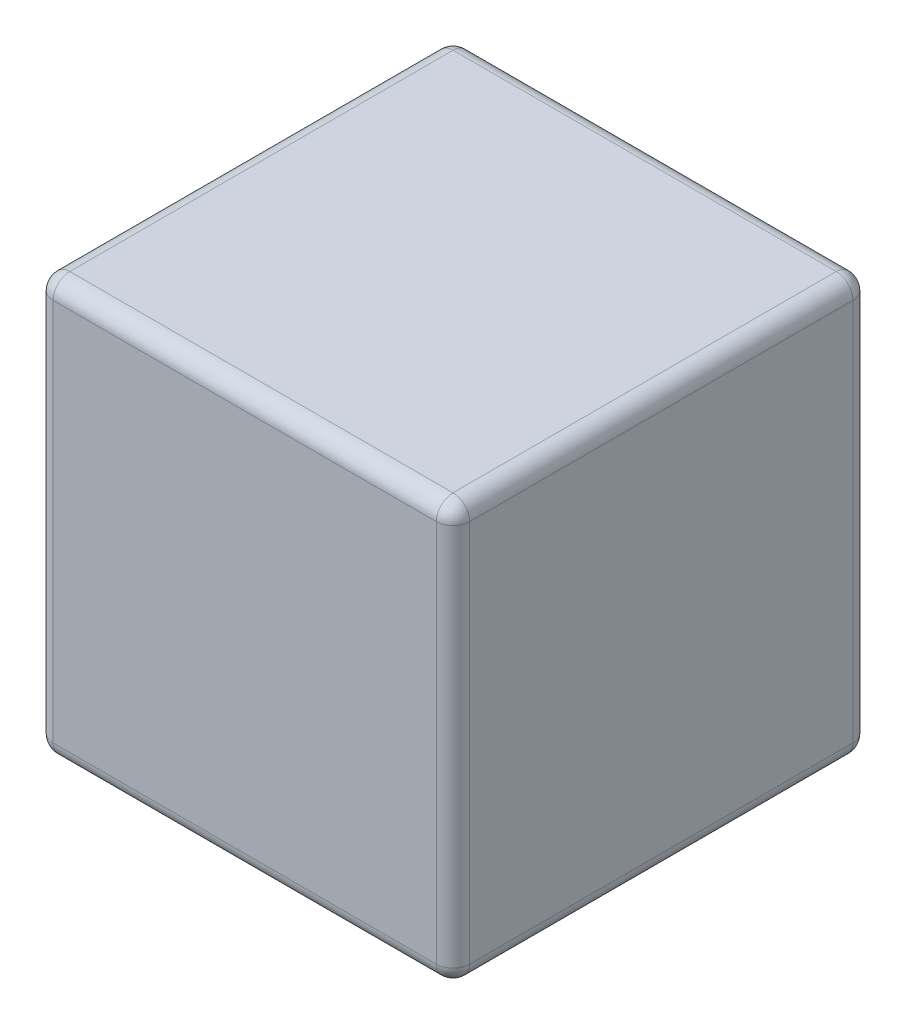
from build123d import *

# Parameters (mm, degrees)
SKETCH1_W           = 250
SKETCH1_H           = 250
BOSS_EXTRUDE1_DEPTH = 125
FILLET1_R           = 10
SKETCH2_W           = 2.243589744
SKETCH2_H           = 25
CUT_EXTRUDE1_DEPTH  = 5


with BuildPart() as part:
    # Sketch1 → Boss-Extrude1 (new, symmetric)
    with BuildSketch(Plane(origin=(0, 0, 0), x_dir=(1, 0, 0), z_dir=(0, 1, 0))):
        Rectangle(SKETCH1_W, SKETCH1_H)
    extrude(amount=BOSS_EXTRUDE1_DEPTH, both=True)

    # Fillet1
    fillet1_edges = [part.edges().sort_by_distance(p)[0] for p in [
        (-125, 0, -125),
        (0, -125, -125),
        (-125, -125, 0),
        (125, 0, -125),
        (125, -125, 0),
        (-125, 0, 125),
        (125, 0, 125),
        (0, -125, 125),
        (0, 125, 125),
        (-125, 125, 0),
        (0, 125, -125),
        (125, 125, 0),
    ]]
    fillet(fillet1_edges, radius=FILLET1_R)

    # Sketch2 → Cut-Extrude1 (cut)
    # profile 1 of 11: a face of its own
    with BuildSketch(Plane(origin=(0, 0, -125), x_dir=(-1, 0, 0), z_dir=(0, 0, -1))):
        Polygon((-103.958881832, 105.864219876), (-101.715292089, 105.864219876), (-101.715292089, 83.42832244), (-92.099907473, 83.42832244), (-92.099907473, 80.864219876), (-103.958881832, 80.864219876), align=None)
    # profile 2 of 11: a face of its own
    with BuildSketch(Plane(origin=(0, 0, -125), x_dir=(-1, 0, 0), z_dir=(0, 0, -1))):
        with Locations((-86.811445935, 93.364219876)):
            Rectangle(SKETCH2_W, SKETCH2_H)
    # profile 3 of 11: a face of its own
    with BuildSketch(Plane(origin=(0, 0, -125), x_dir=(-1, 0, 0), z_dir=(0, 0, -1))):
        Polygon((-79.279394653, 105.864219876), (-67.099907473, 105.864219876), (-67.099907473, 103.300117312), (-77.035804909, 103.300117312), (-77.035804909, 95.60780962), (-67.099907473, 95.60780962), (-67.099907473, 93.043707055), (-77.035804909, 93.043707055), (-77.035804909, 80.864219876), (-79.279394653, 80.864219876), align=None)
    # profile 4 of 11: a face of its own
    with BuildSketch(Plane(origin=(0, 0, -125), x_dir=(-1, 0, 0), z_dir=(0, 0, -1))):
        Polygon((-62.612727986, 105.864219876), (-48.510163884, 105.864219876), (-48.510163884, 103.300117312), (-60.369138243, 103.300117312), (-60.369138243, 95.60780962), (-48.510163884, 95.60780962), (-48.510163884, 93.043707055), (-60.369138243, 93.043707055), (-60.369138243, 83.42832244), (-48.510163884, 83.42832244), (-48.510163884, 80.864219876), (-62.612727986, 80.864219876), align=None)
    # profile 5 of 11: a face of its own
    with BuildSketch(Plane(origin=(0, 0, -125), x_dir=(-1, 0, 0), z_dir=(0, 0, -1))):
        with BuildLine():
            Line((-36.971702345, 85.686936222), (-34.858320935, 86.953963466))
            add(Edge.make_bspline(
                [(-34.858320935, 86.953963466), (-34.661762098, 86.624932145), (-34.28516295, 85.994520831), (-33.656938956, 85.142677685), (-33.005989591, 84.41866228), (-32.327494351, 83.826686512), (-31.625594722, 83.360623035), (-30.895708624, 83.030607094), (-30.14029569, 82.824778698), (-29.626196965, 82.79977808), (-29.369538884, 82.787296799)],
                knots=[0, 0, 0, 0, 1.272034388, 2.437168799, 3.508375237, 4.49857839, 5.41946034, 6.295179144, 7.148887113, 8, 8, 8, 8], degree=3))
            add(Edge.make_bspline(
                [(-29.369538884, 82.787296799), (-29.150347023, 82.793401603), (-28.715798644, 82.80550439), (-28.076068337, 82.921795833), (-27.45476975, 83.100453897), (-26.864708051, 83.356317694), (-26.314025091, 83.665878306), (-25.831120124, 84.039779574), (-25.413647887, 84.458395329), (-25.072154211, 84.925414291), (-24.810153959, 85.427679638), (-24.608782042, 85.943222147), (-24.497031516, 86.480140492), (-24.480197563, 86.841643798), (-24.471702345, 87.024075645)],
                knots=[0, 0, 0, 0, 1.095163259, 2.171163733, 3.241058638, 4.321873601, 5.38011039, 6.391990106, 7.366004449, 8.327778327, 9.272591725, 10.192022065, 11.087607919, 12, 12, 12, 12], degree=3))
            add(Edge.make_bspline(
                [(-24.471702345, 87.024075645), (-24.482233136, 87.232224572), (-24.503640695, 87.655360923), (-24.684579838, 88.279644158), (-24.969217315, 88.89744823), (-25.231807628, 89.279600127), (-25.36813664, 89.478001927)],
                knots=[0, 0, 0, 0, 0.938893495, 1.908633276, 2.914225137, 4, 4, 4, 4], degree=3))
            add(Edge.make_bspline(
                [(-25.36813664, 89.478001927), (-25.480069599, 89.621193524), (-25.715058844, 89.921806371), (-26.119041076, 90.369272339), (-26.59308475, 90.830832474), (-27.120967285, 91.324111453), (-27.72191792, 91.826167143), (-28.377114451, 92.360940557), (-29.103284872, 92.908094679), (-29.612566991, 93.275041576), (-29.875348179, 93.464380132)],
                knots=[0, 0, 0, 0, 0.722233717, 1.516239348, 2.393582979, 3.351407094, 4.387010283, 5.505090956, 6.712668013, 8, 8, 8, 8], degree=3))
            add(Edge.make_bspline(
                [(-29.875348179, 93.464380132), (-30.138376723, 93.651727187), (-30.64126727, 94.009920489), (-31.344542858, 94.541522517), (-31.973431879, 95.027550157), (-32.52513914, 95.472578815), (-32.999421975, 95.876668848), (-33.400017768, 96.235939842), (-33.716721747, 96.560108134), (-33.892833038, 96.770403432), (-33.971902666, 96.864820837)],
                knots=[0, 0, 0, 0, 1.452282411, 2.77665338, 3.964542531, 5.026858415, 5.96415736, 6.766646006, 7.446254459, 8, 8, 8, 8], degree=3))
            add(Edge.make_bspline(
                [(-33.971902666, 96.864820837), (-34.082420846, 97.011971101), (-34.29976968, 97.301361842), (-34.586669719, 97.753682255), (-34.830520882, 98.216705579), (-35.021680397, 98.69167604), (-35.182653389, 99.171925532), (-35.290924322, 99.663720144), (-35.358720014, 100.164853133), (-35.365662775, 100.502092423), (-35.369138243, 100.670910581)],
                knots=[0, 0, 0, 0, 1.068054152, 2.10047183, 3.106115577, 4.101338837, 5.06977816, 6.043150881, 7.020423561, 8, 8, 8, 8], degree=3))
            add(Edge.make_bspline(
                [(-35.369138243, 100.670910581), (-35.359815321, 100.935408971), (-35.341368749, 101.458752283), (-35.185365055, 102.223258215), (-34.9391301, 102.953161195), (-34.594166615, 103.641235007), (-34.149471237, 104.269563442), (-33.634857135, 104.845374064), (-33.021917947, 105.329435365), (-32.34939921, 105.752378639), (-31.613282266, 106.083420962), (-30.841918671, 106.333142249), (-30.034082442, 106.474636947), (-29.486917194, 106.494942411), (-29.209282473, 106.505245517)],
                knots=[0, 0, 0, 0, 1.005424448, 1.989358655, 2.955360095, 3.929531133, 4.905563448, 5.876582895, 6.856512386, 7.866279853, 8.892233794, 9.918561126, 10.94386622, 12, 12, 12, 12], degree=3))
            add(Edge.make_bspline(
                [(-29.209282473, 106.505245517), (-28.914681757, 106.495084434), (-28.328814959, 106.474877283), (-27.467034848, 106.299180631), (-26.637315445, 106.008461547), (-25.969863553, 105.678542561), (-25.447486686, 105.349032449), (-25.049110024, 105.048890847), (-24.645413947, 104.703354357), (-24.233142126, 104.311502599), (-23.819280273, 103.869740092), (-23.397684186, 103.381092314), (-22.96736798, 102.848545486), (-22.690540408, 102.468370481), (-22.548625422, 102.273474684)],
                knots=[0, 0, 0, 0, 1.286793592, 2.559021753, 3.825965368, 5.121522368, 5.803751409, 6.523245864, 7.299691795, 8.125521123, 9.008227632, 9.944561021, 10.946284179, 12, 12, 12, 12], degree=3))
            Line((-22.548625422, 102.273474684), (-24.576870614, 100.736014748))
            add(Edge.make_bspline(
                [(-24.576870614, 100.736014748), (-24.699341561, 100.893791108), (-24.935191968, 101.197631488), (-25.293259732, 101.623140885), (-25.630750074, 102.011830025), (-25.96325293, 102.349438082), (-26.27320744, 102.65445332), (-26.574043456, 102.91559444), (-26.861431679, 103.135420122), (-27.223695327, 103.370016979), (-27.678821886, 103.602563433), (-28.250140002, 103.799342562), (-28.847184824, 103.917593004), (-29.253825049, 103.933227915), (-29.459683114, 103.941142953)],
                knots=[0, 0, 0, 0, 1.181633172, 2.275549214, 3.290209073, 4.226197932, 5.078386478, 5.862611352, 6.581680152, 7.217281963, 8.414376989, 9.595101626, 10.782541182, 12, 12, 12, 12], degree=3))
            add(Edge.make_bspline(
                [(-29.459683114, 103.941142953), (-29.717943989, 103.932487953), (-30.215975756, 103.915797602), (-30.923048871, 103.733511992), (-31.55943405, 103.446498705), (-32.106238086, 103.044248861), (-32.561502208, 102.567670342), (-32.890826913, 102.019249948), (-33.089042375, 101.413661358), (-33.113230086, 100.991220956), (-33.125548499, 100.77607885)],
                knots=[0, 0, 0, 0, 1.14458467, 2.207223713, 3.21896685, 4.227309161, 5.202851033, 6.127160689, 7.046193047, 8, 8, 8, 8], degree=3))
            add(Edge.make_bspline(
                [(-33.125548499, 100.77607885), (-33.122740452, 100.642139718), (-33.117119765, 100.374042436), (-33.038728353, 99.977960851), (-32.938018861, 99.582879855), (-32.778428634, 99.190575692), (-32.558105037, 98.794187413), (-32.268782352, 98.386889287), (-31.904401551, 97.965091368), (-31.625280034, 97.690752984), (-31.477912281, 97.545910581)],
                knots=[0, 0, 0, 0, 0.858281714, 1.717966888, 2.583508476, 3.4729293, 4.427298488, 5.488583878, 6.674047936, 8, 8, 8, 8], degree=3))
            add(Edge.make_bspline(
                [(-31.477912281, 97.545910581), (-31.423188193, 97.497074682), (-31.293176284, 97.381051766), (-31.055491101, 97.191106904), (-30.74161397, 96.956801388), (-30.359741105, 96.666891984), (-29.902831378, 96.330595826), (-29.370834549, 95.952212882), (-28.769680743, 95.519459604), (-28.343095629, 95.216905742), (-28.117535679, 95.056928209)],
                knots=[0, 0, 0, 0, 0.420754252, 0.999615792, 1.744751191, 2.668019286, 3.750313428, 4.999500688, 6.413464383, 8, 8, 8, 8], degree=3))
            add(Edge.make_bspline(
                [(-28.117535679, 95.056928209), (-27.846207726, 94.859489927), (-27.320818752, 94.477178057), (-26.57326461, 93.902780343), (-25.895451695, 93.341010567), (-25.285000241, 92.795456231), (-24.735879466, 92.270255566), (-24.254181462, 91.759089993), (-23.834998031, 91.265621616), (-23.383717899, 90.632960361), (-22.922590616, 89.855952617), (-22.526579849, 88.903965198), (-22.276877367, 87.948277195), (-22.244223686, 87.305942649), (-22.228112602, 86.989019555)],
                knots=[0, 0, 0, 0, 1.163667725, 2.253281268, 3.268753668, 4.215851969, 5.092017293, 5.902905408, 6.650798638, 7.335211899, 8.59617414, 9.77448103, 10.901945474, 12, 12, 12, 12], degree=3))
            add(Edge.make_bspline(
                [(-22.228112602, 86.989019555), (-22.232806445, 86.764888376), (-22.242102982, 86.320978494), (-22.348966651, 85.669156516), (-22.505535688, 85.036078875), (-22.741515931, 84.429570929), (-23.02953849, 83.83853691), (-23.395011689, 83.278480479), (-23.818638008, 82.737006203), (-24.304593472, 82.228552693), (-24.836349917, 81.761794151), (-25.398376308, 81.346586569), (-25.991592543, 81.000384259), (-26.612780519, 80.717878244), (-27.262082924, 80.496924547), (-27.93928138, 80.336832625), (-28.645492175, 80.238577547), (-29.125495614, 80.228379251), (-29.369538884, 80.223194235)],
                knots=[0, 0, 0, 0, 0.983748083, 1.948392443, 2.894712957, 3.844097841, 4.80183111, 5.778335162, 6.776009319, 7.81870978, 8.863265674, 9.881300176, 10.883814829, 11.87499822, 12.874611388, 13.892143829, 14.928324115, 16, 16, 16, 16], degree=3))
            add(Edge.make_bspline(
                [(-29.369538884, 80.223194235), (-29.558362762, 80.226845532), (-29.933632477, 80.234102142), (-30.488700205, 80.298254145), (-31.032554413, 80.389019171), (-31.558370713, 80.53311967), (-32.072923654, 80.707955221), (-32.573975329, 80.923229025), (-33.061768571, 81.181209035), (-33.53903702, 81.476173497), (-34.004566838, 81.819443101), (-34.453991609, 82.21925379), (-34.90205722, 82.664578826), (-35.335538622, 83.167511421), (-35.763203939, 83.719926299), (-36.17662115, 84.326991894), (-36.584347704, 84.985401564), (-36.840172475, 85.448723605), (-36.971702345, 85.686936222)],
                knots=[0, 0, 0, 0, 0.915332311, 1.819136955, 2.706846663, 3.586547465, 4.459518054, 5.340707479, 6.227863349, 7.133153174, 8.059268498, 9.028702269, 10.047606654, 11.120612155, 12.245963614, 13.433783089, 14.680604001, 16, 16, 16, 16], degree=3))
        make_face()
    # profile 6 of 11: a face of its own
    with BuildSketch(Plane(origin=(0, 0, -125), x_dir=(-1, 0, 0), z_dir=(0, 0, -1))):
        with BuildLine():
            Line((-17.099907473, 105.864219876), (-14.85631773, 105.864219876))
            Line((-14.85631773, 105.864219876), (-14.85631773, 90.88525353))
            add(Edge.make_bspline(
                [(-14.85631773, 90.88525353), (-14.856651615, 90.673248274), (-14.857285221, 90.270931768), (-14.853052979, 89.69830105), (-14.841200347, 89.189212056), (-14.833727779, 88.741702431), (-14.817103968, 88.357825663), (-14.80354649, 88.035502016), (-14.786113942, 87.776257712), (-14.765163103, 87.624965383), (-14.756157473, 87.559933017)],
                knots=[0, 0, 0, 0, 1.528628734, 2.90083645, 4.128790002, 5.200304208, 6.127813768, 6.898992206, 7.526736466, 8, 8, 8, 8], degree=3))
            add(Edge.make_bspline(
                [(-14.756157473, 87.559933017), (-14.719175625, 87.325313279), (-14.647295722, 86.869293785), (-14.46410731, 86.219948915), (-14.208268017, 85.634724213), (-13.905103426, 85.095357848), (-13.505584774, 84.616862419), (-13.026988093, 84.176064899), (-12.447146889, 83.790552008), (-11.802428277, 83.43804621), (-11.107533724, 83.154724193), (-10.39745325, 82.940485876), (-9.682860541, 82.809922306), (-9.204459362, 82.794804171), (-8.966894653, 82.787296799)],
                knots=[0, 0, 0, 0, 1.035780045, 2.013197591, 2.933192213, 3.817615948, 4.702609284, 5.640816605, 6.646850145, 7.73207398, 8.84249596, 9.914020372, 10.964143139, 12, 12, 12, 12], degree=3))
            add(Edge.make_bspline(
                [(-8.966894653, 82.787296799), (-8.762939364, 82.794967158), (-8.356206779, 82.810263575), (-7.751875132, 82.904988082), (-7.163302927, 83.075706408), (-6.587583785, 83.295990397), (-6.047933896, 83.587044619), (-5.544052167, 83.923264901), (-5.09430978, 84.317628301), (-4.68389551, 84.754059333), (-4.326503111, 85.246486476), (-4.016709242, 85.784187462), (-3.762952602, 86.375254226), (-3.63764171, 86.790642956), (-3.573264845, 87.004043594)],
                knots=[0, 0, 0, 0, 0.994687771, 1.983630487, 2.973142513, 3.978332533, 4.983357753, 5.956394766, 6.925816176, 7.893390482, 8.871859704, 9.88551698, 10.913711441, 12, 12, 12, 12], degree=3))
            add(Edge.make_bspline(
                [(-3.573264845, 87.004043594), (-3.551835379, 87.092247696), (-3.504081892, 87.288801983), (-3.459460142, 87.621096915), (-3.41298496, 88.013163801), (-3.380738032, 88.467819606), (-3.349300743, 88.983540839), (-3.33049308, 89.563014107), (-3.321799988, 90.204135256), (-3.319209414, 90.651543554), (-3.317856191, 90.88525353)],
                knots=[0, 0, 0, 0, 0.558680831, 1.244966039, 2.062412453, 2.990489873, 4.051219941, 5.244515665, 6.560634259, 8, 8, 8, 8], degree=3))
            Line((-3.317856191, 90.88525353), (-3.317856191, 105.864219876))
            Line((-3.317856191, 105.864219876), (-1.074266448, 105.864219876))
            Line((-1.074266448, 105.864219876), (-1.074266448, 90.765061222))
            add(Edge.make_bspline(
                [(-1.074266448, 90.765061222), (-1.076081593, 90.492929944), (-1.07962396, 89.961849209), (-1.110342364, 89.183625216), (-1.159320934, 88.445389635), (-1.228521563, 87.747043231), (-1.320214443, 87.091084951), (-1.422180303, 86.471765178), (-1.552034111, 85.893529517), (-1.703701262, 85.351869391), (-1.877083748, 84.83625858), (-2.101663379, 84.346911333), (-2.354695522, 83.868951335), (-2.654800185, 83.409607701), (-2.992024347, 82.966846607), (-3.373822067, 82.543353214), (-3.787566073, 82.132360026), (-4.240134356, 81.744409554), (-4.724066679, 81.38863329), (-5.237923519, 81.075792068), (-5.777757589, 80.811337658), (-6.342165633, 80.593652483), (-6.931388511, 80.429976775), (-7.54544108, 80.308011376), (-8.185721032, 80.238709251), (-8.621182862, 80.228409751), (-8.841694332, 80.223194235)],
                knots=[0, 0, 0, 0, 1.316592851, 2.569410997, 3.76748051, 4.895814652, 5.963796859, 6.97159953, 7.931736103, 8.829262218, 9.692595152, 10.560224239, 11.431080259, 12.30701507, 13.211635791, 14.121146779, 15.063487852, 16.031507147, 17.00238618, 17.966455255, 18.938106653, 19.907068911, 20.888905087, 21.893141452, 22.933117798, 24, 24, 24, 24], degree=3))
            add(Edge.make_bspline(
                [(-8.841694332, 80.223194235), (-9.082187923, 80.228799701), (-9.554035486, 80.239797606), (-10.249307395, 80.302817249), (-10.915837369, 80.421520066), (-11.560665062, 80.572662521), (-12.17501147, 80.781117787), (-12.767107501, 81.024675822), (-13.326812366, 81.32379911), (-13.863206142, 81.65660906), (-14.3619544, 82.031070761), (-14.819792994, 82.439214861), (-15.237477784, 82.874503271), (-15.607968472, 83.341648741), (-15.937403362, 83.837018076), (-16.221190601, 84.362012646), (-16.46485663, 84.91642919), (-16.590617823, 85.301809193), (-16.654194332, 85.496631735)],
                knots=[0, 0, 0, 0, 1.13879206, 2.234305948, 3.301075583, 4.341971843, 5.366689343, 6.369221514, 7.369726634, 8.367512178, 9.355451585, 10.318319045, 11.268648973, 12.207971039, 13.137398894, 14.081662264, 15.030215811, 16, 16, 16, 16], degree=3))
            add(Edge.make_bspline(
                [(-16.654194332, 85.496631735), (-16.691174034, 85.629721552), (-16.771383829, 85.918396331), (-16.857278812, 86.396156963), (-16.929486538, 86.946263518), (-16.997383383, 87.568753649), (-17.037447368, 88.264109839), (-17.07257193, 89.032030667), (-17.100154922, 89.873444679), (-17.099992262, 90.459548362), (-17.099907473, 90.765061222)],
                knots=[0, 0, 0, 0, 0.625038921, 1.35572334, 2.194682327, 3.136881307, 4.189498639, 5.346923369, 6.617055217, 8, 8, 8, 8], degree=3))
            Line((-17.099907473, 90.765061222), (-17.099907473, 105.864219876))
        make_face()
    # profile 7 of 11: a face of its own
    with BuildSketch(Plane(origin=(0, 0, -125), x_dir=(-1, 0, 0), z_dir=(0, 0, -1))):
        with BuildLine():
            Line((5.335989962, 105.864219876), (10.238834514, 105.864219876))
            add(Edge.make_bspline(
                [(10.238834514, 105.864219876), (10.576055272, 105.863849189), (11.222185221, 105.863138935), (12.148721333, 105.841605036), (12.990219416, 105.81284295), (13.744864994, 105.772972284), (14.41497998, 105.725853782), (14.99753212, 105.659767787), (15.497100379, 105.590765676), (15.796432161, 105.520612772), (15.932945091, 105.488618914)],
                knots=[0, 0, 0, 0, 1.415646017, 2.712440637, 3.8905458, 4.950247383, 5.884950622, 6.709939814, 7.411656543, 8, 8, 8, 8], degree=3))
            add(Edge.make_bspline(
                [(15.932945091, 105.488618914), (16.105756046, 105.441319273), (16.447305883, 105.347834546), (16.939456191, 105.160593664), (17.407697945, 104.938578199), (17.853637648, 104.685550057), (18.271795384, 104.39065317), (18.668409962, 104.065841615), (19.03998125, 103.703616125), (19.384419764, 103.308039412), (19.700739747, 102.885752198), (19.973094623, 102.430450556), (20.201146245, 101.949798389), (20.396741041, 101.444130023), (20.537515716, 100.909199141), (20.643565, 100.348722624), (20.710876625, 99.762760551), (20.717323495, 99.362332926), (20.720605347, 99.158490709)],
                knots=[0, 0, 0, 0, 0.999701418, 1.975846123, 2.934577507, 3.890451536, 4.834027766, 5.787354733, 6.749476667, 7.726910423, 8.712836071, 9.690891519, 10.682875813, 11.679750201, 12.712814741, 13.765529915, 14.8625177, 16, 16, 16, 16], degree=3))
            add(Edge.make_bspline(
                [(20.720605347, 99.158490709), (20.71759517, 98.952935161), (20.711705557, 98.550751847), (20.641017804, 97.962374788), (20.54580215, 97.400100573), (20.399394633, 96.865175927), (20.207639825, 96.360777566), (19.982696591, 95.879197338), (19.711385659, 95.428628253), (19.399636876, 95.007434556), (19.052839773, 94.615220897), (18.672461643, 94.254829507), (18.260038126, 93.928369947), (17.816879925, 93.63511035), (17.338666719, 93.38185121), (16.832651336, 93.155013318), (16.294435505, 92.964505742), (15.921988976, 92.864291017), (15.732624578, 92.813338466)],
                knots=[0, 0, 0, 0, 1.121902311, 2.195077645, 3.232258892, 4.234102512, 5.217864754, 6.176164875, 7.132989551, 8.084763148, 9.034132444, 9.988522005, 10.94243251, 11.903244335, 12.886203696, 13.894208494, 14.929344452, 16, 16, 16, 16], degree=3))
            add(Edge.make_bspline(
                [(15.732624578, 92.813338466), (15.576000764, 92.780031458), (15.232750568, 92.707037214), (14.66744541, 92.625548237), (14.009264082, 92.555993946), (13.259104939, 92.503842963), (12.417641333, 92.459197474), (11.484418066, 92.423711089), (10.457603229, 92.404212133), (9.741380057, 92.40320647), (9.367440283, 92.402681414)],
                knots=[0, 0, 0, 0, 0.601384939, 1.31797006, 2.144135048, 3.087295005, 4.142315834, 5.309527816, 6.595305764, 8, 8, 8, 8], degree=3))
            Line((9.367440283, 92.402681414), (7.579579706, 92.402681414))
            Line((7.579579706, 92.402681414), (7.579579706, 80.864219876))
            Line((7.579579706, 80.864219876), (5.335989962, 80.864219876))
            Line((5.335989962, 80.864219876), (5.335989962, 105.864219876))
        make_face()
        with BuildLine():
            Line((7.579579706, 103.300117312), (7.579579706, 94.966783979))
            Line((7.579579706, 94.966783979), (11.956582911, 94.911695837))
            add(Edge.make_bspline(
                [(11.956582911, 94.911695837), (12.170296667, 94.911585383), (12.582866666, 94.911372154), (13.17883969, 94.939838036), (13.73176317, 94.972698983), (14.239938709, 95.020812722), (14.703595384, 95.088821704), (15.123506304, 95.157476975), (15.496415468, 95.256800994), (15.932838337, 95.390537202), (16.419147962, 95.618627314), (16.94820188, 95.949697957), (17.396563211, 96.371703016), (17.784551045, 96.846187525), (18.092450173, 97.374038449), (18.317850119, 97.938816569), (18.450286957, 98.53472978), (18.468045483, 98.9425022), (18.477015603, 99.148474684)],
                knots=[0, 0, 0, 0, 1.160613943, 2.240541288, 3.23993089, 4.169200891, 5.011653406, 5.7853311, 6.478053781, 7.106038997, 8.262395093, 9.384106736, 10.481365981, 11.59014053, 12.70357646, 13.786202915, 14.881775077, 16, 16, 16, 16], degree=3))
            add(Edge.make_bspline(
                [(18.477015603, 99.148474684), (18.4679967, 99.349464065), (18.450068236, 99.749006081), (18.31681207, 100.334568657), (18.0928884, 100.893395117), (17.782484153, 101.41463144), (17.405761797, 101.887408612), (16.967909346, 102.298102376), (16.469957479, 102.628257396), (16.006755829, 102.841352265), (15.595318786, 102.971461375), (15.237947644, 103.06249595), (14.834442826, 103.135178851), (14.384672972, 103.194032443), (13.892124159, 103.244414309), (13.352564767, 103.27859986), (12.768038744, 103.298610262), (12.362248952, 103.2996028), (12.151895411, 103.300117312)],
                knots=[0, 0, 0, 0, 1.120700087, 2.227813068, 3.331159281, 4.466773991, 5.599788987, 6.693661531, 7.80175334, 8.91857717, 9.525282508, 10.207424825, 10.974604443, 11.810962634, 12.737642355, 13.736264703, 14.826523623, 16, 16, 16, 16], degree=3))
            Line((12.151895411, 103.300117312), (7.579579706, 103.300117312))
        make_face(mode=Mode.SUBTRACT)
    # profile 8 of 11: a face of its own
    with BuildSketch(Plane(origin=(0, 0, -125), x_dir=(-1, 0, 0), z_dir=(0, 0, -1))):
        with BuildLine():
            Line((25.848810475, 105.864219876), (30.751655027, 105.864219876))
            add(Edge.make_bspline(
                [(30.751655027, 105.864219876), (31.088875785, 105.863849189), (31.735005733, 105.863138935), (32.661541846, 105.841605036), (33.503039929, 105.81284295), (34.257685507, 105.772972284), (34.927800493, 105.725853782), (35.510352633, 105.659767787), (36.009920892, 105.590765676), (36.309252674, 105.520612772), (36.445765603, 105.488618914)],
                knots=[0, 0, 0, 0, 1.415646017, 2.712440637, 3.8905458, 4.950247383, 5.884950622, 6.709939814, 7.411656543, 8, 8, 8, 8], degree=3))
            add(Edge.make_bspline(
                [(36.445765603, 105.488618914), (36.618576559, 105.441319273), (36.960126396, 105.347834546), (37.452276704, 105.160593664), (37.920518458, 104.938578199), (38.366458161, 104.685550057), (38.784615897, 104.39065317), (39.181230475, 104.065841615), (39.552801763, 103.703616125), (39.897240277, 103.308039412), (40.213560259, 102.885752198), (40.485915136, 102.430450556), (40.713966758, 101.949798389), (40.909561554, 101.444130023), (41.050336229, 100.909199141), (41.156385512, 100.348722624), (41.223697138, 99.762760551), (41.230144008, 99.362332926), (41.23342586, 99.158490709)],
                knots=[0, 0, 0, 0, 0.999701418, 1.975846123, 2.934577507, 3.890451536, 4.834027766, 5.787354733, 6.749476667, 7.726910423, 8.712836071, 9.690891519, 10.682875813, 11.679750201, 12.712814741, 13.765529915, 14.8625177, 16, 16, 16, 16], degree=3))
            add(Edge.make_bspline(
                [(41.23342586, 99.158490709), (41.230415683, 98.952935161), (41.224526069, 98.550751847), (41.153838317, 97.962374788), (41.058622663, 97.400100573), (40.912215146, 96.865175927), (40.720460338, 96.360777566), (40.495517103, 95.879197338), (40.224206172, 95.428628253), (39.912457389, 95.007434556), (39.565660286, 94.615220897), (39.185282156, 94.254829507), (38.772858638, 93.928369947), (38.329700438, 93.63511035), (37.851487232, 93.38185121), (37.345471849, 93.155013318), (36.807256018, 92.964505742), (36.434809489, 92.864291017), (36.245445091, 92.813338466)],
                knots=[0, 0, 0, 0, 1.121902311, 2.195077645, 3.232258892, 4.234102512, 5.217864754, 6.176164875, 7.132989551, 8.084763148, 9.034132444, 9.988522005, 10.94243251, 11.903244335, 12.886203696, 13.894208494, 14.929344452, 16, 16, 16, 16], degree=3))
            add(Edge.make_bspline(
                [(36.245445091, 92.813338466), (36.088821276, 92.780031458), (35.745571081, 92.707037214), (35.180265923, 92.625548237), (34.522084594, 92.555993946), (33.771925452, 92.503842963), (32.930461846, 92.459197474), (31.997238579, 92.423711089), (30.970423742, 92.404212133), (30.25420057, 92.40320647), (29.880260796, 92.402681414)],
                knots=[0, 0, 0, 0, 0.601384939, 1.31797006, 2.144135048, 3.087295005, 4.142315834, 5.309527816, 6.595305764, 8, 8, 8, 8], degree=3))
            Line((29.880260796, 92.402681414), (28.092400219, 92.402681414))
            Line((28.092400219, 92.402681414), (28.092400219, 80.864219876))
            Line((28.092400219, 80.864219876), (25.848810475, 80.864219876))
            Line((25.848810475, 80.864219876), (25.848810475, 105.864219876))
        make_face()
        with BuildLine():
            Line((28.092400219, 103.300117312), (28.092400219, 94.966783979))
            Line((28.092400219, 94.966783979), (32.469403424, 94.911695837))
            add(Edge.make_bspline(
                [(32.469403424, 94.911695837), (32.68311718, 94.911585383), (33.095687179, 94.911372154), (33.691660202, 94.939838036), (34.244583683, 94.972698983), (34.752759222, 95.020812722), (35.216415896, 95.088821704), (35.636326817, 95.157476975), (36.00923598, 95.256800994), (36.44565885, 95.390537202), (36.931968475, 95.618627314), (37.461022393, 95.949697957), (37.909383724, 96.371703016), (38.297371558, 96.846187525), (38.605270686, 97.374038449), (38.830670631, 97.938816569), (38.96310747, 98.53472978), (38.980865996, 98.9425022), (38.989836116, 99.148474684)],
                knots=[0, 0, 0, 0, 1.160613943, 2.240541288, 3.23993089, 4.169200891, 5.011653406, 5.7853311, 6.478053781, 7.106038997, 8.262395093, 9.384106736, 10.481365981, 11.59014053, 12.70357646, 13.786202915, 14.881775077, 16, 16, 16, 16], degree=3))
            add(Edge.make_bspline(
                [(38.989836116, 99.148474684), (38.980817213, 99.349464065), (38.962888749, 99.749006081), (38.829632583, 100.334568657), (38.605708913, 100.893395117), (38.295304666, 101.41463144), (37.918582309, 101.887408612), (37.480729859, 102.298102376), (36.982777992, 102.628257396), (36.519576342, 102.841352265), (36.108139299, 102.971461375), (35.750768157, 103.06249595), (35.347263339, 103.135178851), (34.897493485, 103.194032443), (34.404944672, 103.244414309), (33.86538528, 103.27859986), (33.280859256, 103.298610262), (32.875069465, 103.2996028), (32.664715924, 103.300117312)],
                knots=[0, 0, 0, 0, 1.120700087, 2.227813068, 3.331159281, 4.466773991, 5.599788987, 6.693661531, 7.80175334, 8.91857717, 9.525282508, 10.207424825, 10.974604443, 11.810962634, 12.737642355, 13.736264703, 14.826523623, 16, 16, 16, 16], degree=3))
            Line((32.664715924, 103.300117312), (28.092400219, 103.300117312))
        make_face(mode=Mode.SUBTRACT)
    # profile 9 of 11: a face of its own
    with BuildSketch(Plane(origin=(0, 0, -125), x_dir=(-1, 0, 0), z_dir=(0, 0, -1))):
        with BuildLine():
            add(Edge.make_bspline(
                [(58.060348937, 106.505245517), (58.523263979, 106.493520664), (59.432467314, 106.470492086), (60.768716584, 106.294212775), (62.044395836, 105.989245704), (63.269896827, 105.583081543), (64.430560946, 105.041264505), (65.535124463, 104.386370588), (66.580959276, 103.61153874), (67.553969145, 102.722758548), (68.444375932, 101.755733878), (69.228846549, 100.723748806), (69.886291504, 99.633043075), (70.426189983, 98.486894285), (70.849751481, 97.287894513), (71.142030365, 96.029651637), (71.328731437, 94.720318136), (71.350558419, 93.827269102), (71.361630988, 93.374235902)],
                knots=[0, 0, 0, 0, 1.065120563, 2.091984664, 3.0946048, 4.079830382, 5.057816894, 6.036188127, 7.030412546, 8.04752943, 9.064399622, 10.05169764, 11.02544977, 11.989514704, 12.962713494, 13.945757189, 14.957906945, 16, 16, 16, 16], degree=3))
            add(Edge.make_bspline(
                [(71.361630988, 93.374235902), (71.350560041, 92.924539856), (71.328737923, 92.038136853), (71.141818084, 90.737112252), (70.848668084, 89.48646442), (70.430123325, 88.288281186), (69.892798479, 87.141298587), (69.230975828, 86.048534631), (68.451395752, 85.009631071), (67.564203958, 84.035969177), (66.597053658, 83.1431301), (65.55969461, 82.365138131), (64.47545661, 81.695680098), (63.330387266, 81.161510999), (62.139672717, 80.73456871), (60.892656124, 80.443478495), (59.595180738, 80.255713901), (58.710387854, 80.234153072), (58.26066945, 80.223194235)],
                knots=[0, 0, 0, 0, 1.043624062, 2.057103931, 3.04512605, 4.022047818, 4.998200453, 5.980619268, 6.982898556, 8.009068085, 9.034988726, 10.034168286, 11.015286542, 11.987931943, 12.962482838, 13.94673481, 14.956375938, 16, 16, 16, 16], degree=3))
            add(Edge.make_bspline(
                [(58.26066945, 80.223194235), (57.8076386, 80.234261284), (56.9145942, 80.256077383), (55.603615376, 80.443087418), (54.344488634, 80.735525302), (53.140814697, 81.153449846), (51.991922343, 81.693572923), (50.895564609, 82.352175631), (49.856142129, 83.13365521), (48.882272511, 84.020559315), (47.99120681, 84.9860704), (47.214354126, 86.020600794), (46.555603317, 87.103854056), (46.017293799, 88.238836371), (45.59111909, 89.420060961), (45.300370389, 90.655407229), (45.112256445, 91.937832271), (45.09057897, 92.81099583), (45.079579706, 93.254043594)],
                knots=[0, 0, 0, 0, 1.053102029, 2.075944431, 3.073151272, 4.055350789, 5.033113405, 6.020478099, 7.024410459, 8.052272461, 9.079885166, 10.07527673, 11.055994387, 12.023226415, 12.992069828, 13.970394897, 14.97016774, 16, 16, 16, 16], degree=3))
            add(Edge.make_bspline(
                [(45.079579706, 93.254043594), (45.083398531, 93.551419802), (45.090988005, 94.142420684), (45.182357237, 95.020039257), (45.314940817, 95.883543955), (45.504954478, 96.730479298), (45.753466385, 97.558772046), (46.046695152, 98.374134637), (46.404836905, 99.168304093), (46.809698676, 99.945042605), (47.261568734, 100.692241932), (47.76068123, 101.398524669), (48.28950529, 102.069817503), (48.869243816, 102.688724673), (49.480789853, 103.27325079), (50.134063983, 103.814413055), (50.825080014, 104.317091276), (51.556811298, 104.770093712), (52.311227547, 105.179801817), (53.088918817, 105.531386467), (53.879322899, 105.833144049), (54.686141813, 106.077721372), (55.507233042, 106.270807343), (56.344388646, 106.402288441), (57.196941691, 106.493890712), (57.771308255, 106.501444297), (58.060348937, 106.505245517)],
                knots=[0, 0, 0, 0, 1.037015668, 2.060948919, 3.074880161, 4.083647147, 5.086022904, 6.090072063, 7.104153813, 8.122640571, 9.144368836, 10.147691507, 11.138137339, 12.123020368, 13.103399296, 14.087645067, 15.080126199, 16.082011238, 17.087798457, 18.072939717, 19.057185487, 20.037253025, 21.01195951, 21.997135196, 22.992090687, 24, 24, 24, 24], degree=3))
        make_face()
        with BuildLine():
            add(Edge.make_bspline(
                [(58.170525219, 103.941142953), (57.933277836, 103.93825088), (57.461051173, 103.932494382), (56.759018771, 103.856667842), (56.066219243, 103.748597206), (55.382509514, 103.594443487), (54.710750304, 103.384414538), (54.04468001, 103.142693765), (53.390372482, 102.848257404), (52.749987783, 102.51559523), (52.129165818, 102.147388653), (51.543360807, 101.74044746), (50.991056208, 101.304314929), (50.473604303, 100.837973234), (49.992524502, 100.339047507), (49.538348063, 99.815101534), (49.129279622, 99.251159455), (48.754382645, 98.662513692), (48.418898072, 98.049930969), (48.120574109, 97.419860524), (47.876545475, 96.767162762), (47.677528502, 96.098918779), (47.512529853, 95.416186924), (47.408001823, 94.713788004), (47.331342113, 93.99525149), (47.325914646, 93.509666818), (47.32316945, 93.26405962)],
                knots=[0, 0, 0, 0, 1.008559885, 2.007477868, 2.99961109, 3.989939068, 4.984837346, 5.991145699, 7.001802488, 8.033829008, 9.059044045, 10.069351652, 11.065060232, 12.050310815, 13.029377138, 14.011219647, 14.996725999, 15.989392538, 16.977580475, 17.965360261, 18.951710183, 19.937753436, 20.929683414, 21.935841486, 22.955955122, 24, 24, 24, 24], degree=3))
            add(Edge.make_bspline(
                [(47.32316945, 93.26405962), (47.332275606, 92.9029009), (47.350190234, 92.192389969), (47.507030021, 91.151188941), (47.748615552, 90.150558325), (48.104739598, 89.195973258), (48.550101132, 88.279228381), (49.100293205, 87.408456205), (49.752143816, 86.583421388), (50.492597578, 85.809883752), (51.302045482, 85.103842293), (52.161564981, 84.48410366), (53.061947892, 83.959744733), (54.005542197, 83.532565644), (54.987310333, 83.194067517), (56.013578555, 82.962077295), (57.077510409, 82.809395471), (57.802729374, 82.794732929), (58.170525219, 82.787296799)],
                knots=[0, 0, 0, 0, 1.032063989, 2.030389145, 3.003944642, 3.970395727, 4.937377036, 5.913328081, 6.909231446, 7.93887556, 8.970685674, 9.976071282, 10.964166581, 11.944589148, 12.933237628, 13.927779006, 14.949070134, 16, 16, 16, 16], degree=3))
            add(Edge.make_bspline(
                [(58.170525219, 82.787296799), (58.417735945, 82.790693259), (58.908029062, 82.797429459), (59.637282793, 82.86527715), (60.353398591, 82.974076218), (61.055372018, 83.130723758), (61.742406386, 83.326775232), (62.417369265, 83.559687575), (63.073071339, 83.850267601), (63.717784466, 84.171324398), (64.334900478, 84.537325523), (64.924011423, 84.930455164), (65.470268422, 85.365945312), (65.987333218, 85.825358258), (66.470388139, 86.317957172), (66.916166598, 86.843101613), (67.323167542, 87.404106308), (67.69792216, 87.991859206), (68.03223118, 88.606118154), (68.323510459, 89.238472996), (68.570625572, 89.887366635), (68.770114892, 90.553735002), (68.926439619, 91.236312494), (69.034153332, 91.936013052), (69.109499322, 92.651436927), (69.115178445, 93.135321612), (69.118041244, 93.379243914)],
                knots=[0, 0, 0, 0, 1.047197238, 2.076906641, 3.100256066, 4.114471768, 5.12198147, 6.126382909, 7.136867548, 8.15857795, 9.17633901, 10.174870724, 11.156907918, 12.133735059, 13.104061851, 14.077631395, 15.04955518, 16.038496417, 17.029181396, 18.010275684, 18.986308667, 19.968651475, 20.955262928, 21.950658345, 22.966943676, 24, 24, 24, 24], degree=3))
            add(Edge.make_bspline(
                [(69.118041244, 93.379243914), (69.115176152, 93.621497516), (69.109492713, 94.10205216), (69.034189322, 94.812486577), (68.92632582, 95.507152374), (68.770877905, 96.183322395), (68.570519664, 96.841169003), (68.323467304, 97.480074343), (68.032143737, 98.102418594), (67.697799277, 98.706663572), (67.321971966, 99.286483129), (66.9112988, 99.840786076), (66.45868917, 100.3591628), (65.977074707, 100.854410614), (65.454425526, 101.315966969), (64.89310914, 101.743984973), (64.299940013, 102.148794075), (63.671888331, 102.51397666), (63.023717233, 102.851221179), (62.358617533, 103.140156916), (61.684123964, 103.385672055), (61.001951734, 103.595078948), (60.306359031, 103.747993449), (59.602045968, 103.856765234), (58.889986978, 103.93246799), (58.411106837, 103.938242122), (58.170525219, 103.941142953)],
                knots=[0, 0, 0, 0, 1.02996197, 2.043119294, 3.035359645, 4.018872909, 4.991431989, 5.957985074, 6.929999688, 7.912076566, 8.892894881, 9.867085534, 10.843653904, 11.817741046, 12.803660682, 13.806313499, 14.818574707, 15.856120519, 16.894564902, 17.924820532, 18.937903209, 19.946497019, 20.957711757, 21.963978472, 22.977135795, 24, 24, 24, 24], degree=3))
        make_face(mode=Mode.SUBTRACT)
    # profile 10 of 11: a face of its own
    with BuildSketch(Plane(origin=(0, 0, -125), x_dir=(-1, 0, 0), z_dir=(0, 0, -1))):
        with BuildLine():
            Line((76.489836116, 105.864219876), (81.492840924, 105.864219876))
            add(Edge.make_bspline(
                [(81.492840924, 105.864219876), (81.826706128, 105.863108547), (82.467764302, 105.860974674), (83.386144805, 105.849076367), (84.220624069, 105.814973826), (84.970765778, 105.785626802), (85.636556171, 105.732112935), (86.220036819, 105.680965456), (86.718520373, 105.614010736), (87.020276453, 105.551829143), (87.156903424, 105.523675004)],
                knots=[0, 0, 0, 0, 1.410062039, 2.707475311, 3.878576406, 4.937260626, 5.877586885, 6.699081471, 7.410979367, 8, 8, 8, 8], degree=3))
            add(Edge.make_bspline(
                [(87.156903424, 105.523675004), (87.339807882, 105.478483823), (87.70171495, 105.389065511), (88.22278685, 105.200068362), (88.719317735, 104.981356758), (89.189245052, 104.724473041), (89.630214989, 104.427510329), (90.046774352, 104.095595169), (90.440813376, 103.730543699), (90.796396449, 103.323151974), (91.131675389, 102.895748334), (91.414451293, 102.433578642), (91.658211862, 101.950282017), (91.852286984, 101.440943319), (92.008558223, 100.910502091), (92.118745647, 100.354153543), (92.184825559, 99.774432292), (92.191553098, 99.379018658), (92.194964321, 99.178522761)],
                knots=[0, 0, 0, 0, 1.027469482, 2.033020251, 3.019912614, 3.986113645, 4.951240523, 5.91722682, 6.890402269, 7.87763091, 8.8651537, 9.85103654, 10.82876324, 11.815024772, 12.821070561, 13.842952187, 14.906261191, 16, 16, 16, 16], degree=3))
            add(Edge.make_bspline(
                [(92.194964321, 99.178522761), (92.184471478, 98.84541487), (92.163997222, 98.1954351), (91.973103624, 97.25214309), (91.660414198, 96.372219414), (91.229533562, 95.556772), (90.680823021, 94.821695962), (90.021360228, 94.176049853), (89.250777288, 93.635764763), (88.533425032, 93.261101872), (87.899752177, 93.021152525), (87.378085657, 92.85232139), (86.809035818, 92.721878781), (86.198054856, 92.605020697), (85.542600174, 92.516794308), (84.84424275, 92.452175776), (84.102484524, 92.411789714), (83.592919743, 92.405775393), (83.330781629, 92.402681414)],
                knots=[0, 0, 0, 0, 1.260483769, 2.459530307, 3.627416485, 4.787058657, 5.939039949, 7.08810263, 8.267026773, 9.491475466, 10.141966685, 10.831826277, 11.566392101, 12.351337768, 13.187381173, 14.07005841, 15.007169909, 16, 16, 16, 16], degree=3))
            Line((83.330781629, 92.402681414), (92.515477142, 80.864219876))
            Line((92.515477142, 80.864219876), (89.741038039, 80.864219876))
            Line((89.741038039, 80.864219876), (80.556342527, 92.402681414))
            Line((80.556342527, 92.402681414), (78.73342586, 92.402681414))
            Line((78.73342586, 92.402681414), (78.73342586, 80.864219876))
            Line((78.73342586, 80.864219876), (76.489836116, 80.864219876))
            Line((76.489836116, 80.864219876), (76.489836116, 105.864219876))
        make_face()
        with BuildLine():
            Line((78.73342586, 103.300117312), (78.73342586, 94.966783979))
            Line((78.73342586, 94.966783979), (83.310749578, 94.931727889))
            add(Edge.make_bspline(
                [(83.310749578, 94.931727889), (83.524464142, 94.931633341), (83.938703835, 94.931450081), (84.537994298, 94.959977054), (85.095995096, 94.992429328), (85.610571897, 95.04206751), (86.081954578, 95.106039451), (86.50990753, 95.186060767), (86.895129329, 95.279289786), (87.344404603, 95.423587113), (87.846094113, 95.652201529), (88.391318826, 95.984812234), (88.855621239, 96.403163085), (89.247891684, 96.881544914), (89.563101909, 97.40751812), (89.785330868, 97.9747779), (89.926348313, 98.5690036), (89.942980781, 98.977418656), (89.951374578, 99.183530773)],
                knots=[0, 0, 0, 0, 1.146690395, 2.22261258, 3.21895312, 4.145990853, 4.996080663, 5.770904154, 6.481378293, 7.121626537, 8.300444488, 9.431385265, 10.535395872, 11.636531494, 12.74115979, 13.810798291, 14.895190096, 16, 16, 16, 16], degree=3))
            add(Edge.make_bspline(
                [(89.951374578, 99.183530773), (89.942787999, 99.384577729), (89.925772532, 99.782979433), (89.786852757, 100.366235935), (89.551928604, 100.916714151), (89.23534119, 101.432174758), (88.849632941, 101.900072871), (88.39736285, 102.300409679), (87.89089717, 102.630762998), (87.417531468, 102.841865716), (86.99442995, 102.971293239), (86.627075235, 103.06237298), (86.211993252, 103.135547758), (85.747168547, 103.194176765), (85.23458547, 103.244569224), (84.671652248, 103.2785105), (84.062103818, 103.298609529), (83.639625738, 103.299603021), (83.42092586, 103.300117312)],
                knots=[0, 0, 0, 0, 1.101028733, 2.181837193, 3.264309656, 4.369019818, 5.486613113, 6.575447106, 7.666700264, 8.788928104, 9.402425223, 10.0903467, 10.862060571, 11.710948788, 12.657782767, 13.684531032, 14.801375019, 16, 16, 16, 16], degree=3))
            Line((83.42092586, 103.300117312), (78.73342586, 103.300117312))
        make_face(mode=Mode.SUBTRACT)
    # profile 11 of 11: a face of its own
    with BuildSketch(Plane(origin=(0, 0, -125), x_dir=(-1, 0, 0), z_dir=(0, 0, -1))):
        Polygon((94.759066886, 103.300117312), (94.759066886, 105.864219876), (107.900092527, 105.864219876), (107.900092527, 103.300117312), (102.451374578, 103.300117312), (102.451374578, 80.864219876), (100.207784834, 80.864219876), (100.207784834, 103.300117312), align=None)
    extrude(amount=-CUT_EXTRUDE1_DEPTH, mode=Mode.SUBTRACT)


solid = part.part
